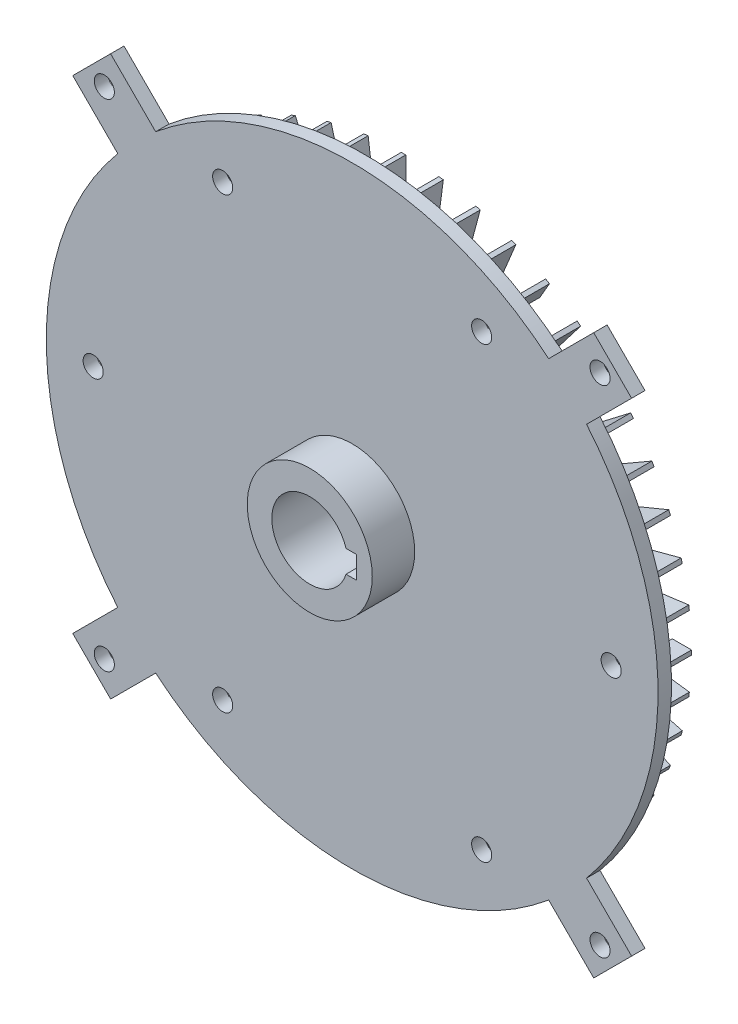
from build123d import *

# Parameters (mm, degrees)
HEAT_SPREADER_START         = -30
SKETCH_1_R                  = 68.5
SKETCH_1_R_2                = 8.5
HEAT_SPREADER_DEPTH         = 3
TIE_ROD_EARS_START          = -30
TIE_ROD_EARS_DEPTH          = 3
COOLING_FINS_START          = -38.5
SKETCH_3_W                  = 38.5
SKETCH_3_H                  = 1
SKETCH_3_W_2                = 1
SKETCH_3_H_2                = 38.5
COOLING_FINS_DEPTH          = 8.5
SKETCH_4_R                  = 2.25
THROUGH_HOLES_DEPTH         = 100
KEYED_REACTION_COLLAR_START = -30
SKETCH_5_R                  = 14
SKETCH_5_R_2                = 8.5
KEYED_REACTION_COLLAR_DEPTH = 12.5
COLLAR_KEYWAY_START         = -30
SKETCH_6_W                  = 5
SKETCH_6_H                  = 5
COLLAR_KEYWAY_DEPTH         = 12.5


with BuildPart() as part:
    # Эскиз1 → Heat_spreader (new body)
    with BuildSketch(Plane.XY.offset(HEAT_SPREADER_START)):
        Circle(SKETCH_1_R)
        Circle(SKETCH_1_R_2, mode=Mode.SUBTRACT)
    extrude(amount=HEAT_SPREADER_DEPTH)

    # Эскиз2 → Tie_rod_ears (add)
    with BuildSketch(Plane.XY.offset(TIE_ROD_EARS_START)):
        Polygon((48.436814511, 39.951533137), (62.578950135, 54.093668761), (54.093668761, 62.578950135), (39.951533137, 48.436814511), align=None)
        Polygon((-39.951533137, 48.436814511), (-54.093668761, 62.578950135), (-62.578950135, 54.093668761), (-48.436814511, 39.951533137), align=None)
        Polygon((-48.436814511, -39.951533137), (-62.578950135, -54.093668761), (-54.093668761, -62.578950135), (-39.951533137, -48.436814511), align=None)
        Polygon((39.951533137, -48.436814511), (54.093668761, -62.578950135), (62.578950135, -54.093668761), (48.436814511, -39.951533137), align=None)
    extrude(amount=TIE_ROD_EARS_DEPTH)

    # Эскиз3 → Cooling_fins (add)
    with BuildSketch(Plane.XY.offset(COOLING_FINS_START)):
        with Locations((45.25, 0)):
            Rectangle(SKETCH_3_W, SKETCH_3_H)
        Polygon((25.842829492, 2.897958567), (64.013456655, 7.923216968), (63.882930463, 8.914661829), (25.7123033, 3.889403428), align=None)
        Polygon((25.243481006, 6.24633226), (62.431625318, 16.210865496), (62.172806273, 17.176791322), (24.984661961, 7.212258086), align=None)
        Polygon((24.212209561, 9.487829475), (59.781571563, 24.221141621), (59.398888131, 25.145021154), (23.829526129, 10.411709008), align=None)
        Polygon((22.766660498, 12.566987298), (56.108638544, 31.816987298), (55.608638544, 32.683012702), (22.266660498, 13.433012702), align=None)
        Polygon((20.931567562, 15.431120484), (51.475671163, 38.868435501), (50.866909734, 39.661788841), (20.322806133, 16.224473824), align=None)
        Polygon((18.738329701, 18.03122292), (45.961940777, 45.254833996), (45.254833996, 45.961940777), (18.03122292, 18.738329701), align=None)
        Polygon((16.224473824, 20.322806133), (39.661788841, 50.866909734), (38.868435501, 51.475671163), (15.431120484, 20.931567562), align=None)
        Polygon((13.433012702, 22.266660498), (32.683012702, 55.608638544), (31.816987298, 56.108638544), (12.566987298, 22.766660498), align=None)
        Polygon((10.411709008, 23.829526129), (25.145021154, 59.398888131), (24.221141621, 59.781571563), (9.487829475, 24.212209561), align=None)
        Polygon((7.212258086, 24.984661961), (17.176791322, 62.172806273), (16.210865496, 62.431625318), (6.24633226, 25.243481006), align=None)
        Polygon((3.889403428, 25.7123033), (8.914661829, 63.882930463), (7.923216968, 64.013456655), (2.897958567, 25.842829492), align=None)
        with Locations((0, 45.25)):
            Rectangle(SKETCH_3_W_2, SKETCH_3_H_2)
        Polygon((-2.897958567, 25.842829492), (-7.923216968, 64.013456655), (-8.914661829, 63.882930463), (-3.889403428, 25.7123033), align=None)
        Polygon((-6.24633226, 25.243481006), (-16.210865496, 62.431625318), (-17.176791322, 62.172806273), (-7.212258086, 24.984661961), align=None)
        Polygon((-9.487829475, 24.212209561), (-24.221141621, 59.781571563), (-25.145021154, 59.398888131), (-10.411709008, 23.829526129), align=None)
        Polygon((-12.566987298, 22.766660498), (-31.816987298, 56.108638544), (-32.683012702, 55.608638544), (-13.433012702, 22.266660498), align=None)
        Polygon((-15.431120484, 20.931567562), (-38.868435501, 51.475671163), (-39.661788841, 50.866909734), (-16.224473824, 20.322806133), align=None)
        Polygon((-18.03122292, 18.738329701), (-45.254833996, 45.961940777), (-45.961940777, 45.254833996), (-18.738329701, 18.03122292), align=None)
        Polygon((-20.322806133, 16.224473824), (-50.866909734, 39.661788841), (-51.475671163, 38.868435501), (-20.931567562, 15.431120484), align=None)
        Polygon((-22.266660498, 13.433012702), (-55.608638544, 32.683012702), (-56.108638544, 31.816987298), (-22.766660498, 12.566987298), align=None)
        Polygon((-23.829526129, 10.411709008), (-59.398888131, 25.145021154), (-59.781571563, 24.221141621), (-24.212209561, 9.487829475), align=None)
        Polygon((-24.984661961, 7.212258086), (-62.172806273, 17.176791322), (-62.431625318, 16.210865496), (-25.243481006, 6.24633226), align=None)
        Polygon((-25.7123033, 3.889403428), (-63.882930463, 8.914661829), (-64.013456655, 7.923216968), (-25.842829492, 2.897958567), align=None)
        with Locations((-45.25, 0)):
            Rectangle(SKETCH_3_W, SKETCH_3_H)
        Polygon((-25.842829492, -2.897958567), (-64.013456655, -7.923216968), (-63.882930463, -8.914661829), (-25.7123033, -3.889403428), align=None)
        Polygon((-25.243481006, -6.24633226), (-62.431625318, -16.210865496), (-62.172806273, -17.176791322), (-24.984661961, -7.212258086), align=None)
        Polygon((-24.212209561, -9.487829475), (-59.781571563, -24.221141621), (-59.398888131, -25.145021154), (-23.829526129, -10.411709008), align=None)
        Polygon((-22.766660498, -12.566987298), (-56.108638544, -31.816987298), (-55.608638544, -32.683012702), (-22.266660498, -13.433012702), align=None)
        Polygon((-20.931567562, -15.431120484), (-51.475671163, -38.868435501), (-50.866909734, -39.661788841), (-20.322806133, -16.224473824), align=None)
        Polygon((-18.738329701, -18.03122292), (-45.961940777, -45.254833996), (-45.254833996, -45.961940777), (-18.03122292, -18.738329701), align=None)
        Polygon((-16.224473824, -20.322806133), (-39.661788841, -50.866909734), (-38.868435501, -51.475671163), (-15.431120484, -20.931567562), align=None)
        Polygon((-13.433012702, -22.266660498), (-32.683012702, -55.608638544), (-31.816987298, -56.108638544), (-12.566987298, -22.766660498), align=None)
        Polygon((-10.411709008, -23.829526129), (-25.145021154, -59.398888131), (-24.221141621, -59.781571563), (-9.487829475, -24.212209561), align=None)
        Polygon((-7.212258086, -24.984661961), (-17.176791322, -62.172806273), (-16.210865496, -62.431625318), (-6.24633226, -25.243481006), align=None)
        Polygon((-3.889403428, -25.7123033), (-8.914661829, -63.882930463), (-7.923216968, -64.013456655), (-2.897958567, -25.842829492), align=None)
        with Locations((0, -45.25)):
            Rectangle(SKETCH_3_W_2, SKETCH_3_H_2)
        Polygon((2.897958567, -25.842829492), (7.923216968, -64.013456655), (8.914661829, -63.882930463), (3.889403428, -25.7123033), align=None)
        Polygon((6.24633226, -25.243481006), (16.210865496, -62.431625318), (17.176791322, -62.172806273), (7.212258086, -24.984661961), align=None)
        Polygon((9.487829475, -24.212209561), (24.221141621, -59.781571563), (25.145021154, -59.398888131), (10.411709008, -23.829526129), align=None)
        Polygon((12.566987298, -22.766660498), (31.816987298, -56.108638544), (32.683012702, -55.608638544), (13.433012702, -22.266660498), align=None)
        Polygon((15.431120484, -20.931567562), (38.868435501, -51.475671163), (39.661788841, -50.866909734), (16.224473824, -20.322806133), align=None)
        Polygon((18.03122292, -18.738329701), (45.254833996, -45.961940777), (45.961940777, -45.254833996), (18.738329701, -18.03122292), align=None)
        Polygon((20.322806133, -16.224473824), (50.866909734, -39.661788841), (51.475671163, -38.868435501), (20.931567562, -15.431120484), align=None)
        Polygon((22.266660498, -13.433012702), (55.608638544, -32.683012702), (56.108638544, -31.816987298), (22.766660498, -12.566987298), align=None)
        Polygon((23.829526129, -10.411709008), (59.398888131, -25.145021154), (59.781571563, -24.221141621), (24.212209561, -9.487829475), align=None)
        Polygon((24.984661961, -7.212258086), (62.172806273, -17.176791322), (62.431625318, -16.210865496), (25.243481006, -6.24633226), align=None)
        Polygon((25.7123033, -3.889403428), (63.882930463, -8.914661829), (64.013456655, -7.923216968), (25.842829492, -2.897958567), align=None)
    extrude(amount=COOLING_FINS_DEPTH)

    # Эскиз4 → Through_holes (cut, symmetric)
    with BuildSketch(Plane.XY):
        with Locations((55.507882323, 55.507882323)):
            Circle(SKETCH_4_R)
        with Locations((-55.507882323, 55.507882323)):
            Circle(SKETCH_4_R)
        with Locations((-55.507882323, -55.507882323)):
            Circle(SKETCH_4_R)
        with Locations((55.507882323, -55.507882323)):
            Circle(SKETCH_4_R)
        with Locations((58, 0)):
            Circle(SKETCH_4_R)
        with Locations((29, 50.229473419)):
            Circle(SKETCH_4_R)
        with Locations((-29, 50.229473419)):
            Circle(SKETCH_4_R)
        with Locations((-58, 0)):
            Circle(SKETCH_4_R)
        with Locations((-29, -50.229473419)):
            Circle(SKETCH_4_R)
        with Locations((29, -50.229473419)):
            Circle(SKETCH_4_R)
    extrude(amount=THROUGH_HOLES_DEPTH, both=True, mode=Mode.SUBTRACT)

    # Эскиз5 → Keyed_reaction_collar (add)
    with BuildSketch(Plane.XY.offset(KEYED_REACTION_COLLAR_START)):
        Circle(SKETCH_5_R)
        Circle(SKETCH_5_R_2, mode=Mode.SUBTRACT)
    extrude(amount=KEYED_REACTION_COLLAR_DEPTH)

    # Эскиз6 → Collar_keyway (cut)
    with BuildSketch(Plane.XY.offset(COLLAR_KEYWAY_START)):
        with Locations((8, 0)):
            Rectangle(SKETCH_6_W, SKETCH_6_H)
    extrude(amount=COLLAR_KEYWAY_DEPTH, mode=Mode.SUBTRACT)


solid = part.part
